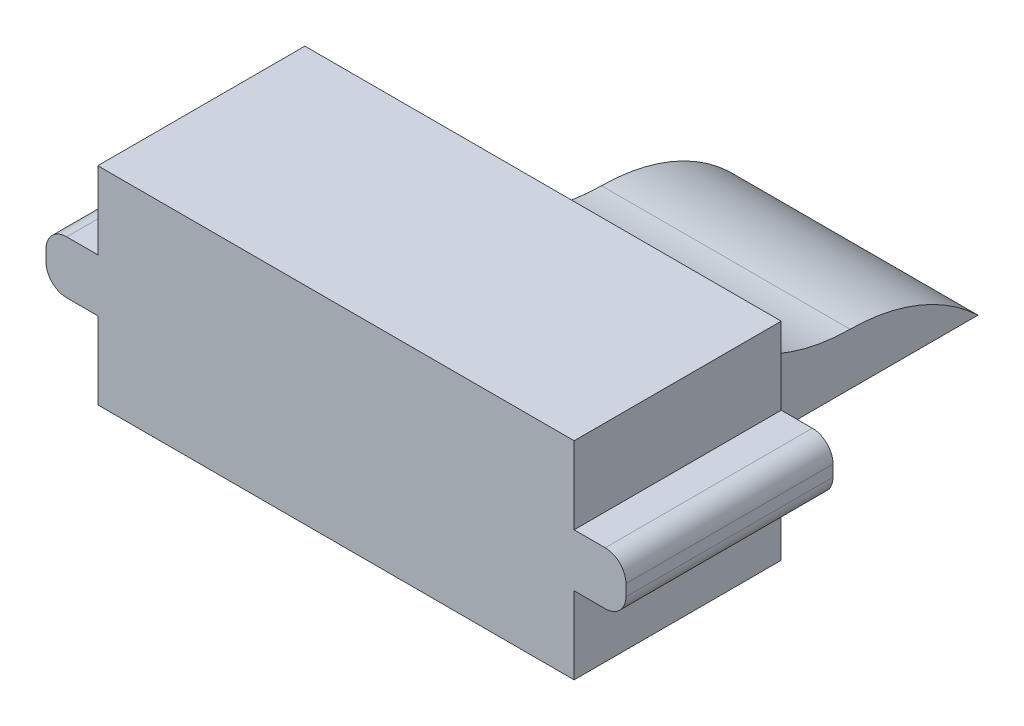
from build123d import *

# Parameters (mm, degrees)
SKETCH_1_W             = 46
SKETCH_1_H             = 20
EXTRUDE_1_DEPTH        = 20
SKETCH_2_W             = 20
SKETCH_2_H             = 5.1
EXTRUDE_2_DEPTH        = 5
FILLET_1_R             = 2
FILLET_1_OF_MIRROR_1_R = 2
SKETCH_3_W             = 24
SKETCH_3_H             = 5
EXTRUDE_3_DEPTH        = 30
FILLET_2_R             = 18
FILLET_3_R             = 18


with BuildPart() as part:
    # 스케치1 → 보스-돌출1 (new body)
    with BuildSketch(Plane.XY):
        Rectangle(SKETCH_1_W, SKETCH_1_H)
    extrude(amount=EXTRUDE_1_DEPTH)

    # 스케치2 → 보스-돌출2 (add)
    with BuildSketch(Plane.ZY.offset(23)):
        with Locations((10, 0)):
            Rectangle(SKETCH_2_W, SKETCH_2_H)
    extrude_2 = extrude(amount=EXTRUDE_2_DEPTH)

    # 필렛1
    fillet_1_edges = [part.edges().sort_by_distance(p)[0] for p in [
        (-28, 2.55, 10),
        (-28, -2.55, 10),
    ]]
    fillet(fillet_1_edges, radius=FILLET_1_R)

    # 대칭 복사1: 보스-돌출2 across plane
    add(extrude_2.mirror(Plane(origin=(0, 0, 0), x_dir=(0, 0, 1), z_dir=(1, 0, 0))))

    # 필렛1 of 대칭 복사1
    fillet_1_of_mirror_1_edges = [part.edges().sort_by_distance(p)[0] for p in [
        (28, 2.55, 10),
        (28, -2.55, 10),
    ]]
    fillet(fillet_1_of_mirror_1_edges, radius=FILLET_1_OF_MIRROR_1_R)

    # 스케치3 → 보스-돌출3 (add)
    with BuildSketch(Plane(origin=(0, 0, 0), x_dir=(-1, 0, 0), z_dir=(0, 0, -1))):
        with Locations((0, -7.5)):
            Rectangle(SKETCH_3_W, SKETCH_3_H)
    extrude(amount=EXTRUDE_3_DEPTH)

    # 필렛2
    # the kernel refuses this fillet: 18 mm, written as the material it adds along each edge
    with BuildSketch(Plane(origin=(-12, -5, 0), x_dir=(0, 1, 0), z_dir=(1, 0, 0))) as fillet_2_piece_1:
        with BuildLine():
            CenterArc((18, -17.748239349), FILLET_2_R, 99.594068227, 80.405931773)
            Line((0, -17.748239349), (0, 0))
            Line((0, 0), (15, 0))
        make_face()
    extrude(amount=24)

    # 필렛3
    # the kernel refuses this fillet: 18 mm, written as the material it takes off along each edge
    with BuildSketch(Plane(origin=(-42.877791108, -5, -30), x_dir=(0, -1, 0), z_dir=(1, 0, 0))) as fillet_3_piece_1:
        with BuildLine():
            CenterArc((17.999451575, -12.45047223), FILLET_3_R, 136.235733455, 43.448005638)
            Line((-0.000274212, -12.35111644), (-1.800246791, -12.341180861))
            ThreePointArc((-1.800246791, -12.341180861), (-1.8, -12.251760651), (-1.8, 0))
            Line((-1.8, 0), (0, 1.8))
            ThreePointArc((0, 1.8), (2.5, 1.8), (3.700054842, 1.245047223))
            Line((3.700054842, 1.245047223), (5, 0))
        make_face()
    extrude(amount=85.755582217, mode=Mode.SUBTRACT)


solid = part.part
